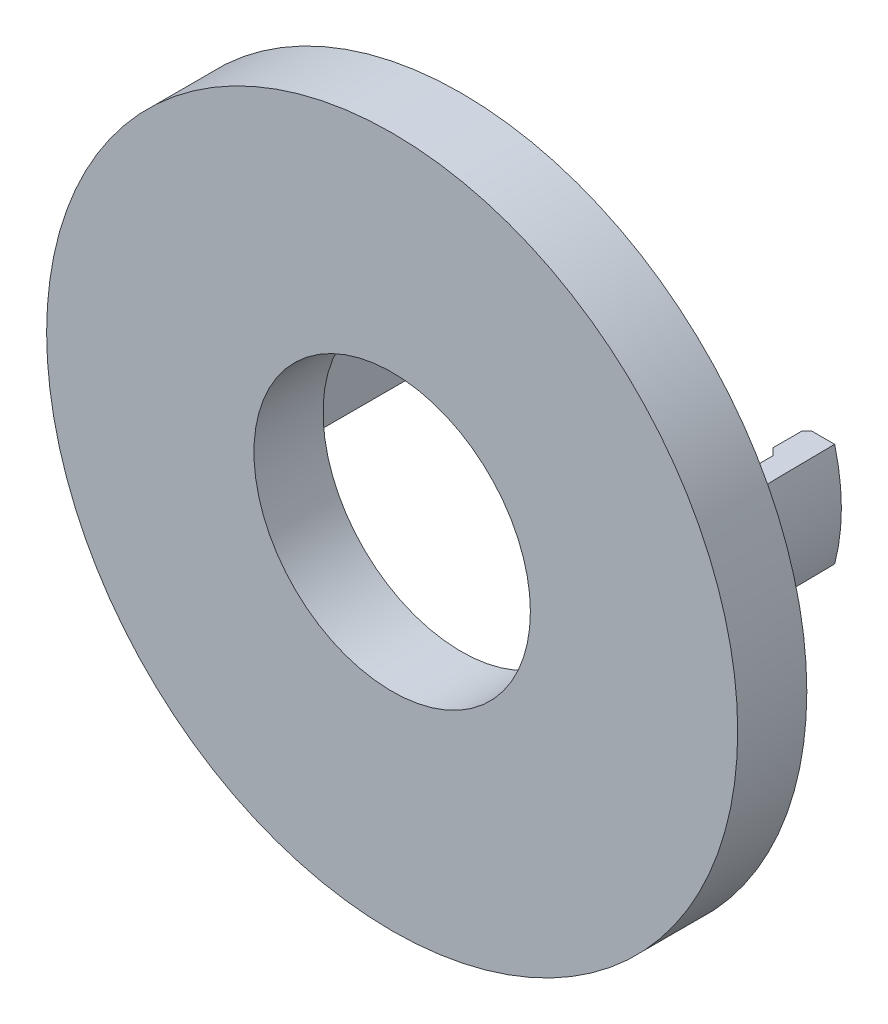
from build123d import *

# Parameters (mm, degrees)
GUARD_BASE_R           = 25
GUARD_DEPTH            = 5
INNER_AXLE_HOLE_BASE_R = 10
INNER_AXLE_HOLE_DEPTH  = 36.707142143
COUPLING_TOOTH_DEPTH   = 3.75


with BuildPart() as part:
    # Guard base → Guard (new body)
    with BuildSketch(Plane.XY):
        Circle(GUARD_BASE_R)
    extrude(amount=GUARD_DEPTH)

    # Inner axle hole base → Inner axle hole (cut, through all)
    with BuildSketch(Plane.XY.offset(5)):
        Circle(INNER_AXLE_HOLE_BASE_R)
    extrude(amount=-INNER_AXLE_HOLE_DEPTH, mode=Mode.SUBTRACT)

    # Coupling tooth base → Coupling tooth (add, symmetric)
    with BuildSketch(Plane(origin=(0, 0, 0), x_dir=(1, 0, 0), z_dir=(0, 1, 0))):
        Polygon((15.5, 12.75), (12.603553391, 12.75), (12.25, 12.396446609), (12.25, 10.310660172), (12.75, 9.810660172), (12.75, 2.396446609), (10.353553391, 0), (15.5, 0), align=None)
    coupling_tooth = extrude(amount=COUPLING_TOOTH_DEPTH, both=True)

    # Sketch6<4> → Circularity cut (revolve, cut)
    with BuildSketch(Plane(origin=(0, 0, 0), x_dir=(1, 0, 0), z_dir=(0, 1, 0))):
        with BuildLine():
            add(Edge.make_bspline(
                [(14.75, 12.75), (14.75, 3.446446626), (15.5, 0)],
                knots=[0, 0, 0, 1, 1, 1], degree=2))
            Line((15.5, 0), (25, 0))
            Line((25, 0), (25, 12.75))
            Line((25, 12.75), (14.75, 12.75))
        make_face()
    circularity_cut = revolve(axis=Axis((0, 0, 0), (0, 0, -1)), mode=Mode.SUBTRACT)

    # Coutpling teeth: Coupling tooth, Circularity cut across plane
    add(coupling_tooth.mirror(Plane(origin=(0, 0, 0), x_dir=(0, 0, 1), z_dir=(1, 0, 0))))
    add(circularity_cut.mirror(Plane(origin=(0, 0, 0), x_dir=(0, 0, 1), z_dir=(1, 0, 0))), mode=Mode.SUBTRACT)


solid = part.part
